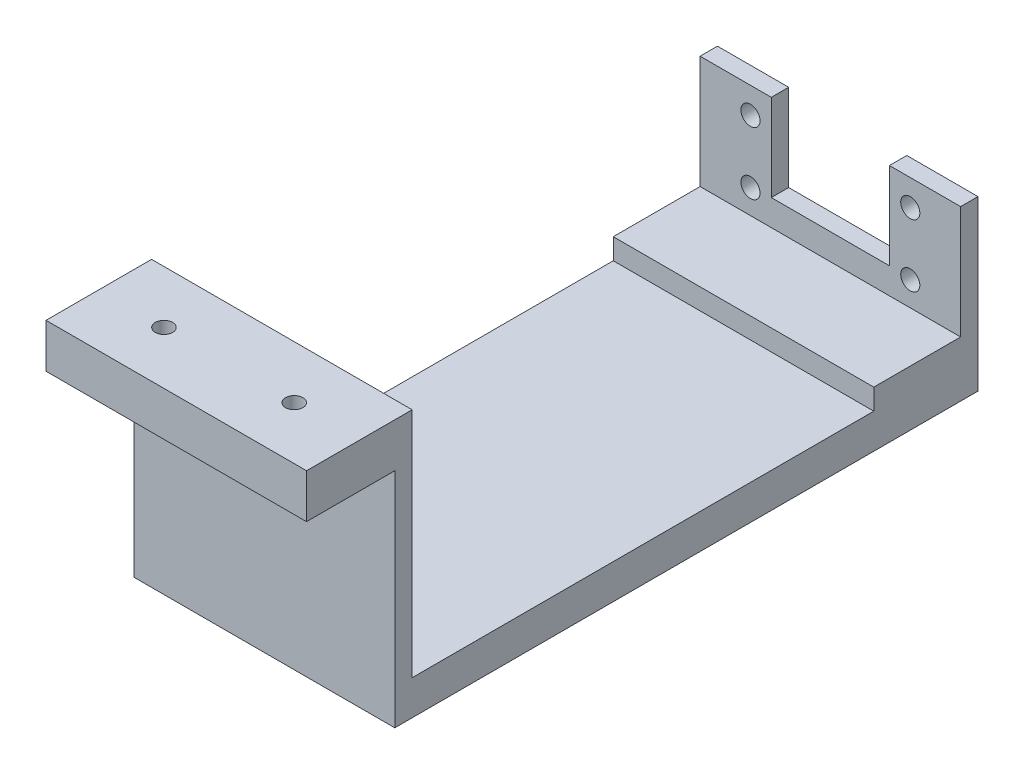
from build123d import *

# Parameters (mm, degrees)
SKETCH1_R                = 2.75
BOSS_EXTRUDE1_DEPTH      = 5
BOSS_EXTRUDE2_DEPTH      = 25
BOSS_EXTRUDE2_DEPTH_BACK = 5
SKETCH2_W                = 75
SKETCH2_H                = 6
SKETCH3_W                = 75
SKETCH3_H                = 10
BOSS_EXTRUDE3_DEPTH      = 167.8942
SKETCH4_W                = 75
SKETCH4_H                = 5
BOSS_EXTRUDE4_DEPTH      = 66.8
SKETCH5_W                = 75
SKETCH5_H                = 12.7
BOSS_EXTRUDE5_DEPTH      = 25.4
M5X0_8_TAPPED_HOLE1_D    = 5


with BuildPart() as part:
    # Sketch1 → Boss-Extrude1 (new body)
    with BuildSketch(Plane.XY):
        Polygon((20.5, 7.5), (20.5, 32.5), (0, 32.5), (0, 0), (75, 0), (75, 32.5), (54.5, 32.5), (54.5, 7.5), align=None)
        with Locations((14.5, 7)):
            Circle(SKETCH1_R, mode=Mode.SUBTRACT)
        with Locations((14.5, 25)):
            Circle(SKETCH1_R, mode=Mode.SUBTRACT)
        with Locations((60.5, 25)):
            Circle(SKETCH1_R, mode=Mode.SUBTRACT)
        with Locations((60.5, 7)):
            Circle(SKETCH1_R, mode=Mode.SUBTRACT)
    extrude(amount=BOSS_EXTRUDE1_DEPTH)

    # Sketch2 → Boss-Extrude2 (add, two sides: drawn at the far end of the back side and taken through both)
    with BuildSketch(Plane.XY.offset(5).offset(-BOSS_EXTRUDE2_DEPTH_BACK)):
        with Locations((37.5, -3)):
            Rectangle(SKETCH2_W, SKETCH2_H)
    extrude(amount=BOSS_EXTRUDE2_DEPTH + BOSS_EXTRUDE2_DEPTH_BACK)

    # Sketch3 → Boss-Extrude3 (add)
    with BuildSketch(Plane(origin=(0, 0, 0), x_dir=(-1, 0, 0), z_dir=(0, 0, -1))):
        with Locations((-37.5, -11)):
            Rectangle(SKETCH3_W, SKETCH3_H)
    extrude(amount=-BOSS_EXTRUDE3_DEPTH)

    # Sketch4 → Boss-Extrude4 (add)
    with BuildSketch(Plane(origin=(0, -6, 0), x_dir=(1, 0, 0), z_dir=(0, 1, 0))):
        with Locations((37.5, -165.3942)):
            Rectangle(SKETCH4_W, SKETCH4_H)
    extrude(amount=BOSS_EXTRUDE4_DEPTH)

    # Sketch5 → Boss-Extrude5 (add)
    with BuildSketch(Plane.XY.offset(167.8942)):
        with Locations((37.5, 54.45)):
            Rectangle(SKETCH5_W, SKETCH5_H)
    extrude(amount=BOSS_EXTRUDE5_DEPTH)

    # M5x0.8 Tapped Hole1 (through all)
    with Locations(Plane(origin=(0, 60.8, 0), x_dir=(1, 0, 0), z_dir=(0, 1, 0))):
        with Locations((56.25, -178.0942), (18.75, -178.0942)):
            Hole(M5X0_8_TAPPED_HOLE1_D / 2)


solid = part.part
